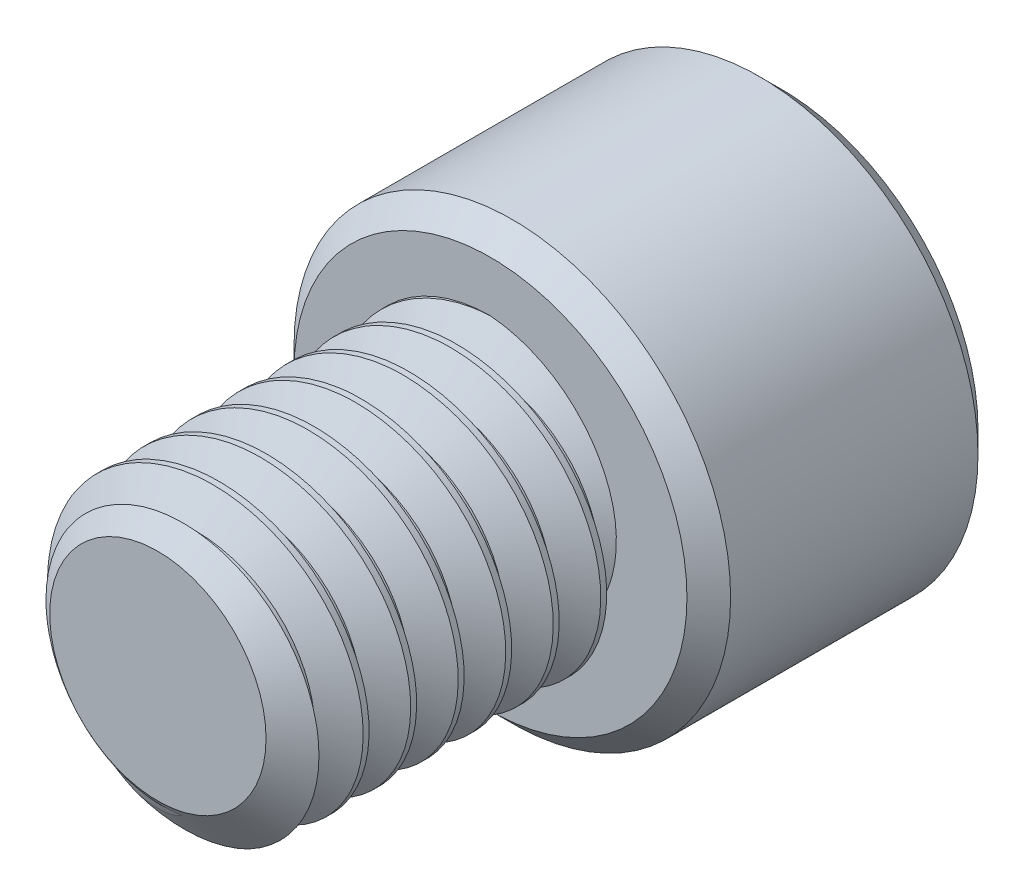
from build123d import *

# Parameters (mm, degrees)
SKETCH1_R          = 5.5626
EXTRUDE1_DEPTH     = 12.7
CUT_SWEEP1_PITCH   = 1.814285714
SKETCH6_R          = 8.334375
EXTRUDE2_DEPTH     = 11.1125
CUT_EXTRUDE1_DEPTH = 7.14375
CHAMFER1_SIZE      = 0.8334375


with BuildPart() as part:
    # Sketch1 → Extrude1 (new body)
    with BuildSketch(Plane.XY):
        Circle(SKETCH1_R)
    extrude(amount=-EXTRUDE1_DEPTH)

    # Cut-Sweep1: the profile of Sketch3 profile screwed along a right-hand helix of 8 turns, 6 arcs to a turn; built about Z, then put on its axis
    cut_sweep1_z = Axis((0, 0, 0), (0, 0, 1))
    cut_sweep1_corners = [(5.5629, 0, -1.587673205), (4.384186861, 0, -0.907142857), (4.384186861, 0, -0.680357143), (5.5629, 0, 0.000173205)]
    with BuildLine(mode=Mode.PRIVATE) as cut_sweep1_profile:
        Line(cut_sweep1_corners[0], cut_sweep1_corners[1])
        Line(cut_sweep1_corners[1], cut_sweep1_corners[2])
        Line(cut_sweep1_corners[2], cut_sweep1_corners[3])
        Line(cut_sweep1_corners[3], cut_sweep1_corners[0])
    cut_sweep1_cap = Face(cut_sweep1_profile.wire())
    cut_sweep1_turn_angles = [0, 30, 60, 90, 120, 150, 180, 210, 240, 270, 300, 330, 360]
    cut_sweep1_turn_weights = [1, 0.8660254037844387, 1, 0.8660254037844387, 1, 0.8660254037844387, 1, 0.8660254037844387, 1, 0.8660254037844387, 1, 0.8660254037844387, 1]
    cut_sweep1_turn_rails = [Edge.make_bspline([Vector(p[0], p[1], 0).rotate(cut_sweep1_z, cut_sweep1_turn_angles[k]) / cut_sweep1_turn_weights[k] + Vector(0, 0, p[2] + CUT_SWEEP1_PITCH * cut_sweep1_turn_angles[k] / 360) for k in range(13)], [0, 0, 0, 1, 1, 2, 2, 3, 3, 4, 4, 5, 5, 6, 6, 6], 2, cut_sweep1_turn_weights) for p in cut_sweep1_corners]
    cut_sweep1_turn_sides = [Face.make_surface_from_curves(cut_sweep1_turn_rails[p[0]], cut_sweep1_turn_rails[p[1]]) for p in [(0, 1), (1, 2), (2, 3), (3, 0)]]
    cut_sweep1 = Plane(origin=(0, 0, 0), x_dir=(0, 1, 0), z_dir=(0, 0, -1)) * Solid(Shell([*[p.moved(Location((0, 0, CUT_SWEEP1_PITCH * i))) for i in range(8) for p in cut_sweep1_turn_sides], cut_sweep1_cap, cut_sweep1_cap.rotate(cut_sweep1_z, 2880).moved(Location((0, 0, CUT_SWEEP1_PITCH * 2880 / 360)))]))
    add(cut_sweep1, mode=Mode.SUBTRACT)

    # Sketch4 → Cut-Revolve1 (revolve, cut)
    with BuildSketch(Plane(origin=(0, 0, 0), x_dir=(0, 0, -1), z_dir=(1, 0, 0)), mode=Mode.PRIVATE) as cut_revolve1_sk:
        Polygon((1.002986478, 5.5626), (0, 4.130186861), (0, 5.5626), align=None)
    revolve(cut_revolve1_sk.sketch.rotate(Axis((0, 0, 0), (0, 0, -1)), 215.058586431), axis=Axis((0, 0, 0), (0, 0, -1)), mode=Mode.SUBTRACT)

    # Sketch6 → Extrude2 (add)
    with BuildSketch(Plane(origin=(0, 0, -12.7), x_dir=(-1, 0, 0), z_dir=(0, 0, -1))):
        Circle(SKETCH6_R)
    extrude(amount=EXTRUDE2_DEPTH)

    # Sketch7 → Cut-Extrude1 (cut)
    with BuildSketch(Plane(origin=(0, 0, -23.8125), x_dir=(-1, 0, 0), z_dir=(0, 0, -1))):
        Polygon((0, 5.499261314), (-4.7625, 2.749630657), (-4.7625, -2.749630657), (0, -5.499261314), (4.7625, -2.749630657), (4.7625, 2.749630657), align=None)
    extrude(amount=-CUT_EXTRUDE1_DEPTH, mode=Mode.SUBTRACT)

    # Cut-Extrude2 cone 1 section (through the dimple's axis) → Cut-Extrude2 (revolve, cut)
    with BuildSketch(Plane(origin=(0, 0, -23.8125), x_dir=(0, 1, 0), z_dir=(1, 0, 0))):
        Polygon((0, 0), (5.499261314, 0), (0, 5.499261314), align=None)
    revolve(axis=Axis((0, 0, -23.8125), (0, 0, 1)), mode=Mode.SUBTRACT)

    # Chamfer1
    chamfer1_edges = [part.edges().sort_by_distance(p)[0] for p in [
        (8.334375, 0, -12.7),
        (8.334375, 0, -23.8125),
    ]]
    chamfer(chamfer1_edges, length=CHAMFER1_SIZE)


solid = part.part
